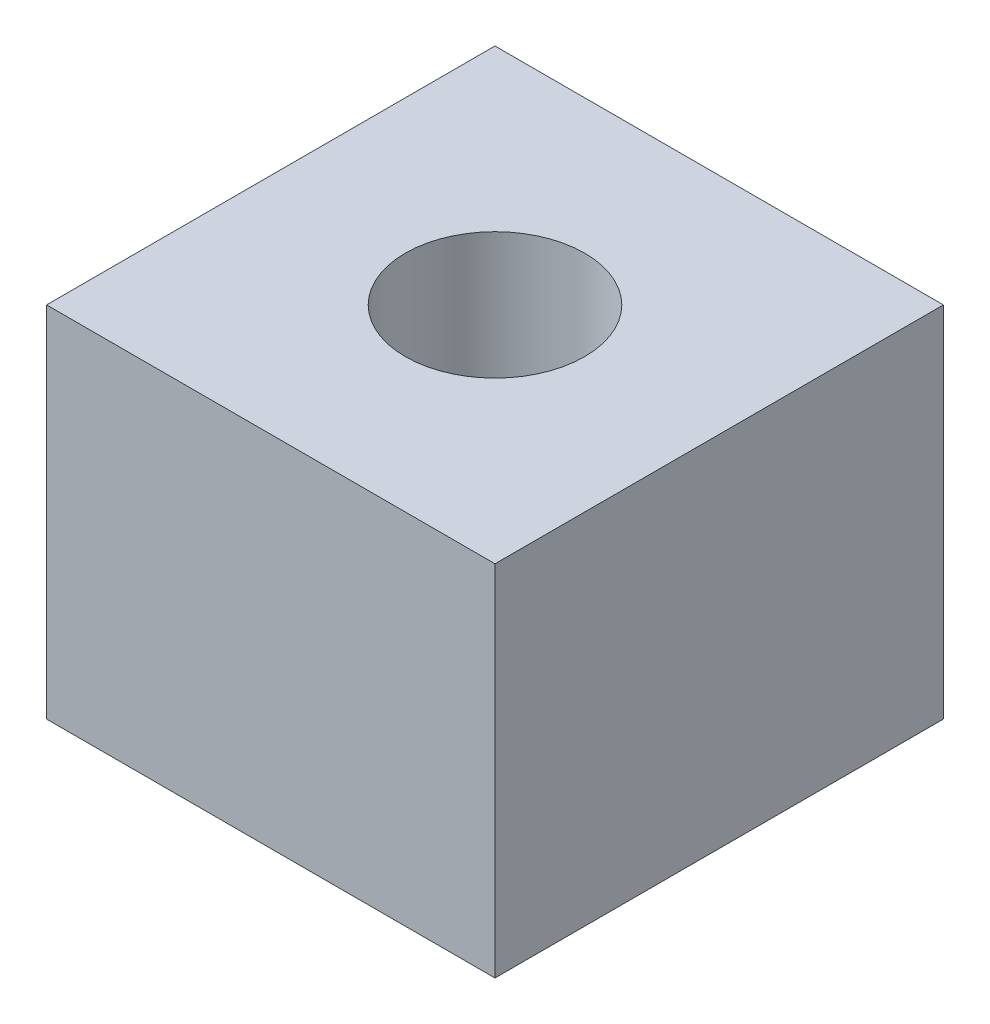
from build123d import *

# Parameters (mm, degrees)
SKETCH1_W               = 2.5
SKETCH1_H               = 2.5
BOSS_EXTRUDE1_DEPTH     = 2
CUT_EXTRUDE1_DEPTH      = 3.669269563
CUT_EXTRUDE1_DEPTH_BACK = 3.669269563
SKETCH2_R               = 0.5


with BuildPart() as part:
    # Sketch1 → Boss-Extrude1 (new body)
    with BuildSketch(Plane(origin=(0, 0, 0), x_dir=(1, 0, 0), z_dir=(0, 1, 0))):
        Rectangle(SKETCH1_W, SKETCH1_H)
    extrude(amount=BOSS_EXTRUDE1_DEPTH)

    # Sketch2 → Cut-Extrude1 (cut, two sides: drawn at the far end of the back side and taken through both)
    with BuildSketch(Plane(origin=(0, 2, 0), x_dir=(1, 0, 0), z_dir=(0, 1, 0)).offset(-CUT_EXTRUDE1_DEPTH_BACK)):
        Circle(SKETCH2_R)
    extrude(amount=CUT_EXTRUDE1_DEPTH + CUT_EXTRUDE1_DEPTH_BACK, mode=Mode.SUBTRACT)


solid = part.part
